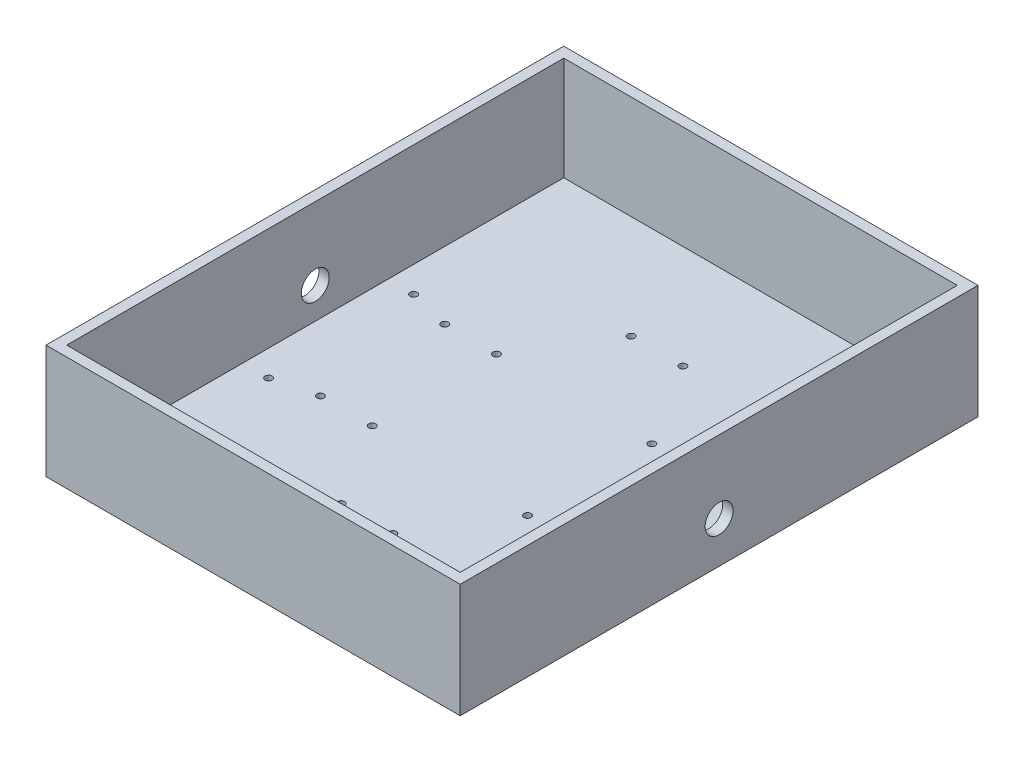
from build123d import *

# Parameters (mm, degrees)
SKETCH1_W               = 190
SKETCH1_H               = 50
BOSS_EXTRUDE1_DEPTH     = 120
SHELL1_T                = 5
CUT_EXTRUDE1_DEPTH      = 168.705098312
CUT_EXTRUDE1_DEPTH_BACK = 168.705098312
SKETCH2_R               = 1.7
CUT_EXTRUDE2_DEPTH      = 168.705098312
CUT_EXTRUDE2_DEPTH_BACK = 168.705098312
SKETCH3_R               = 6.75


with BuildPart() as part:
    # Sketch1 → Boss-Extrude1 (new, symmetric)
    with BuildSketch(Plane.XY):
        with Locations((0, 25)):
            Rectangle(SKETCH1_W, SKETCH1_H)
    extrude(amount=BOSS_EXTRUDE1_DEPTH, both=True)

    # Shell1
    shell1_openings = [part.faces().sort_by_distance(p)[0] for p in [
        (0, 50, 0),
    ]]
    offset(amount=SHELL1_T, openings=shell1_openings, kind=Kind.INTERSECTION)

    # Sketch2 → Cut-Extrude1 (cut, two sides: drawn at the far end of the back side and taken through both)
    with BuildSketch(Plane(origin=(0, 0, 0), x_dir=(1, 0, 0), z_dir=(0, 1, 0)).offset(-CUT_EXTRUDE1_DEPTH_BACK)):
        with Locations((-12.5, 70)):
            Circle(SKETCH2_R)
        with Locations((-37.5, 30)):
            Circle(SKETCH2_R)
        with Locations((-62.5, 30)):
            Circle(SKETCH2_R)
        with Locations((-82.5, 35)):
            Circle(SKETCH2_R)
        with Locations((82.5, 35)):
            Circle(SKETCH2_R)
        with Locations((62.5, 30)):
            Circle(SKETCH2_R)
        with Locations((37.5, 30)):
            Circle(SKETCH2_R)
        with Locations((12.5, 70)):
            Circle(SKETCH2_R)
        with Locations((12.5, -70)):
            Circle(SKETCH2_R)
        with Locations((37.5, -30)):
            Circle(SKETCH2_R)
        with Locations((62.5, -30)):
            Circle(SKETCH2_R)
        with Locations((82.5, -35)):
            Circle(SKETCH2_R)
        with Locations((-82.5, -35)):
            Circle(SKETCH2_R)
        with Locations((-62.5, -30)):
            Circle(SKETCH2_R)
        with Locations((-37.5, -30)):
            Circle(SKETCH2_R)
        with Locations((-12.5, -70)):
            Circle(SKETCH2_R)
    extrude(amount=CUT_EXTRUDE1_DEPTH + CUT_EXTRUDE1_DEPTH_BACK, mode=Mode.SUBTRACT)

    # Sketch3 → Cut-Extrude2 (cut, two sides: drawn at the far end of the back side and taken through both)
    with BuildSketch(Plane(origin=(0, 0, 0), x_dir=(0, 0, -1), z_dir=(1, 0, 0)).offset(-CUT_EXTRUDE2_DEPTH_BACK)):
        with Locations((0, 15)):
            Circle(SKETCH3_R)
    extrude(amount=CUT_EXTRUDE2_DEPTH + CUT_EXTRUDE2_DEPTH_BACK, mode=Mode.SUBTRACT)


solid = part.part
